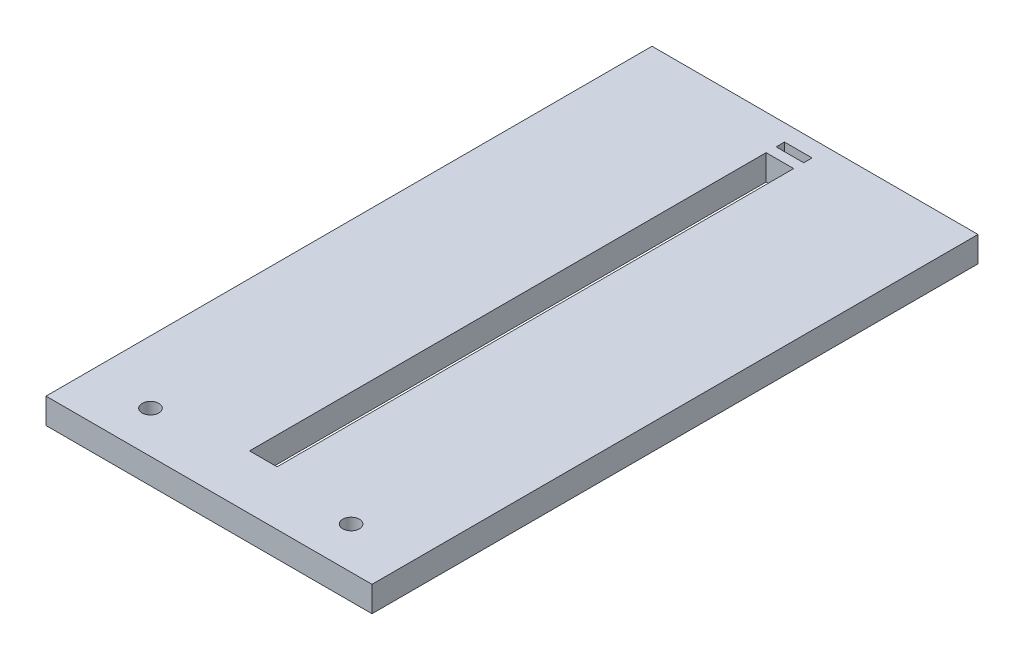
from build123d import *

# Parameters (mm, degrees)
SKETCH1_W           = 39
SKETCH1_H           = 72.5
BOSS_EXTRUDE1_DEPTH = 3.05
SKETCH4_W           = 3.3
SKETCH4_H           = 1
SKETCH4_H_2         = 61.8
CUT_EXTRUDE1_DEPTH  = 76.138555349
SKETCH7_R           = 1
CUT_EXTRUDE4_DEPTH  = 76.138555349


with BuildPart() as part:
    # Sketch1 → Boss-Extrude1 (new body)
    with BuildSketch(Plane(origin=(0, 0, 0), x_dir=(1, 0, 0), z_dir=(0, 1, 0))):
        with Locations((0, 36.25)):
            Rectangle(SKETCH1_W, SKETCH1_H)
    extrude(amount=BOSS_EXTRUDE1_DEPTH)

    # Sketch4 → Cut-Extrude1 (cut, through all)
    with BuildSketch(Plane(origin=(0, 3.05, 0), x_dir=(1, 0, 0), z_dir=(0, 1, 0))):
        with Locations((0, 70)):
            Rectangle(SKETCH4_W, SKETCH4_H)
        with Locations((0, 37.4)):
            Rectangle(SKETCH4_W, SKETCH4_H_2)
    extrude(amount=-CUT_EXTRUDE1_DEPTH, mode=Mode.SUBTRACT)

    # Sketch7 → Cut-Extrude4 (cut, through all)
    with BuildSketch(Plane(origin=(0, 3.05, 0), x_dir=(1, 0, 0), z_dir=(0, 1, 0))):
        with Locations((-12, 5)):
            Circle(SKETCH7_R)
        with Locations((12, 5)):
            Circle(SKETCH7_R)
    extrude(amount=-CUT_EXTRUDE4_DEPTH, mode=Mode.SUBTRACT)


solid = part.part
